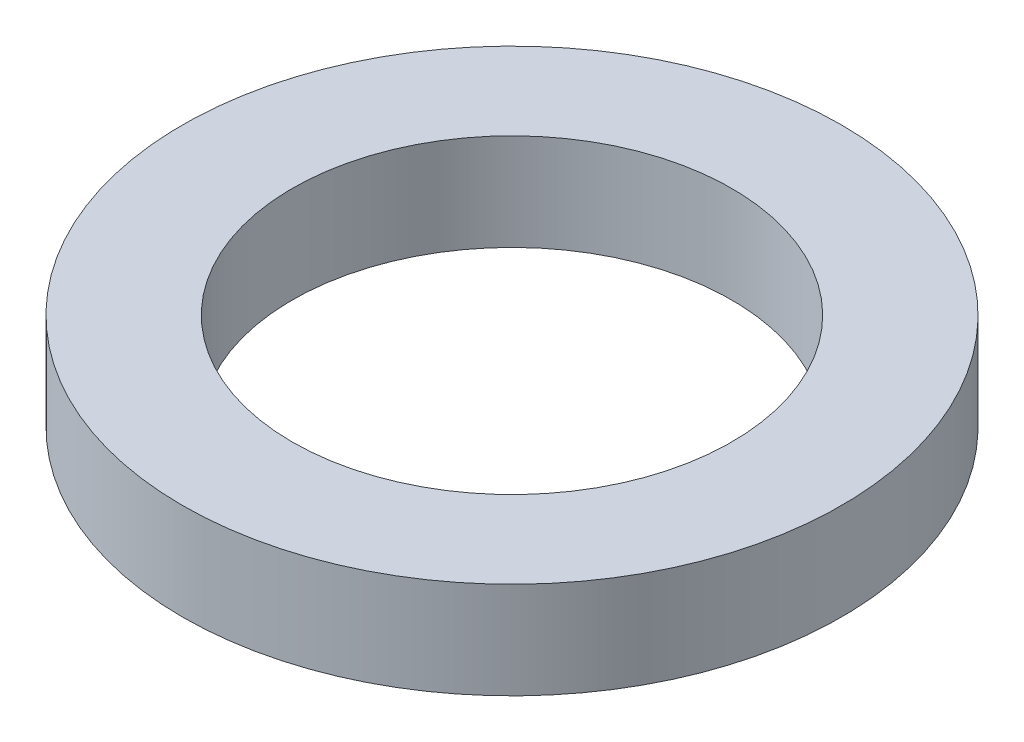
from build123d import *

# Parameters (mm, degrees)
SKETCH1_R           = 75
BOSS_EXTRUDE1_DEPTH = 22
SKETCH2_R           = 50
CUT_EXTRUDE1_DEPTH  = 109.323589305


with BuildPart() as part:
    # Sketch1 → Boss-Extrude1 (new body)
    with BuildSketch(Plane(origin=(0, 0, 0), x_dir=(1, 0, 0), z_dir=(0, 1, 0))):
        Circle(SKETCH1_R)
    extrude(amount=BOSS_EXTRUDE1_DEPTH)

    # Sketch2 → Cut-Extrude1 (cut, through all)
    with BuildSketch(Plane(origin=(0, 0, 0), x_dir=(1, 0, 0), z_dir=(0, 1, 0))):
        Circle(SKETCH2_R)
    extrude(amount=CUT_EXTRUDE1_DEPTH, mode=Mode.SUBTRACT)


solid = part.part
